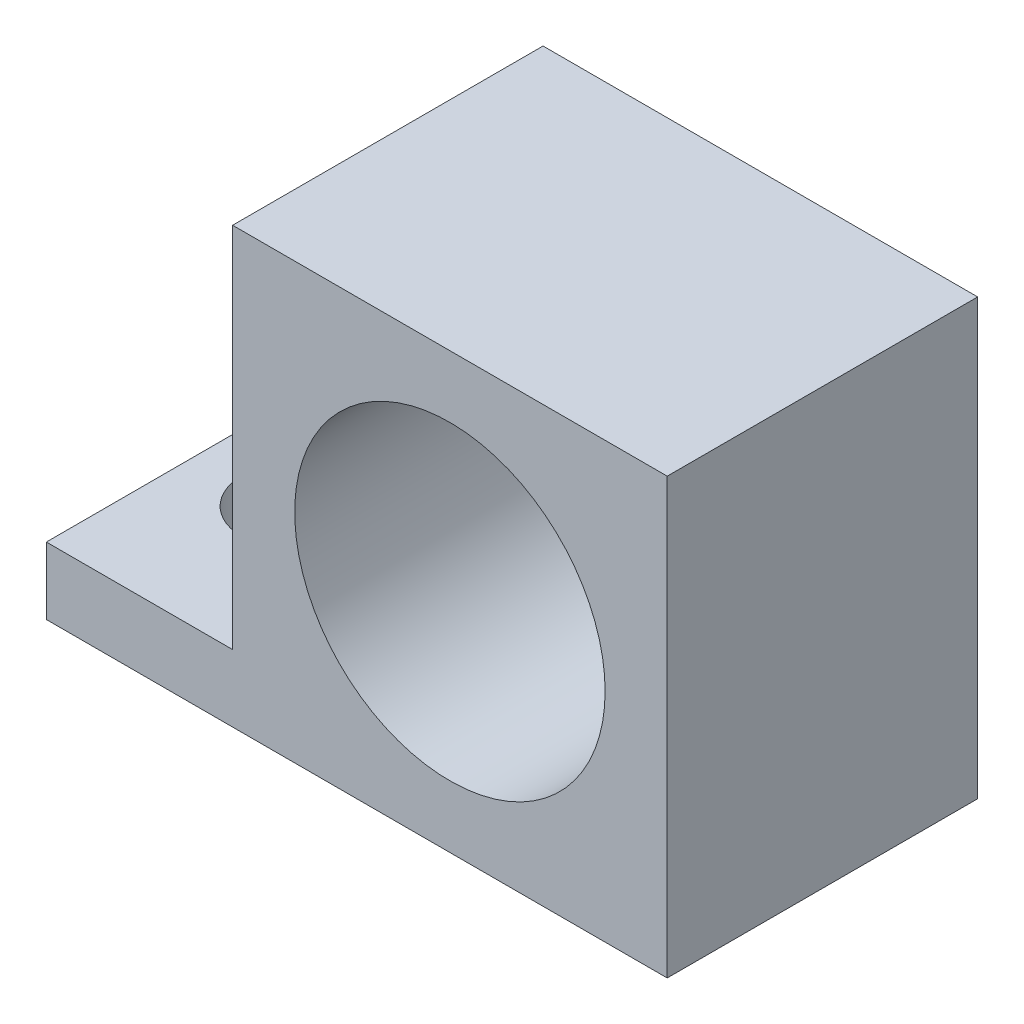
from build123d import *

# Parameters (mm, degrees)
SKETCH1_R            = 5
BOSS_EXTRUDE1_DEPTH  = 10
M3_CLEARANCE_HOLE1_D = 3.4


with BuildPart() as part:
    # Sketch1 → Boss-Extrude1 (new body)
    with BuildSketch(Plane.XY):
        Polygon((0, 0), (20, 0), (20, 14), (6, 14), (6, 2.162314815), (0, 2.162314815), align=None)
        with Locations((13, 7)):
            Circle(SKETCH1_R, mode=Mode.SUBTRACT)
    extrude(amount=BOSS_EXTRUDE1_DEPTH)

    # M3 Clearance Hole1 (through all)
    with Locations(Plane(origin=(0, 2.162314815, 0), x_dir=(-1, 0, 0), z_dir=(0, 1, 0))):
        with Locations((-3, 5)):
            Hole(M3_CLEARANCE_HOLE1_D / 2)


solid = part.part
